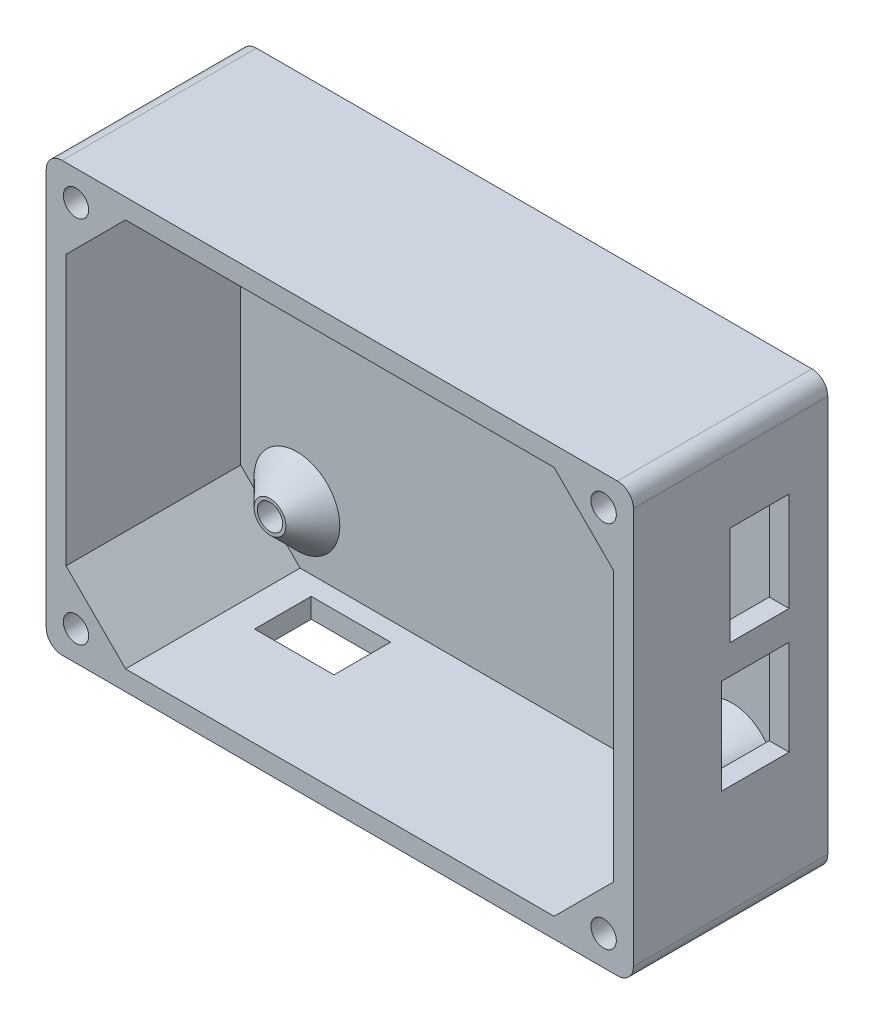
from build123d import *

# Parameters (mm, degrees)
SKETCH5_W           = 74
SKETCH5_H           = 54
BOSS_EXTRUDE4_DEPTH = 24.5
SHELL1_T            = -2.5
SKETCH6_R           = 2
BOSS_EXTRUDE5_DEPTH = 3.4
SKETCH11_R          = 1.6
CUT_EXTRUDE2_DEPTH  = 4.5
CUT_EXTRUDE4_REACH  = 84.494
SKETCH12_W          = 7.45
SKETCH12_H          = 12.5
CUT_EXTRUDE5_REACH  = 84.494
SKETCH13_W          = 8.5
SKETCH13_H          = 12
CUT_EXTRUDE6_REACH  = 71.895
SKETCH14_W          = 10
SKETCH14_H          = 7.138154435
BOSS_EXTRUDE7_DEPTH = 22
SKETCH9_R           = 1.6
CUT_EXTRUDE1_DEPTH  = 6.1
CHAMFER10_SIZE      = 3.4
CHAMFER11_SIZE      = 3.4
FILLET1_R           = 2


with BuildPart() as part:
    # Sketch5 → Boss-Extrude4 (new body)
    with BuildSketch(Plane.XY):
        Rectangle(SKETCH5_W, SKETCH5_H)
    extrude(amount=BOSS_EXTRUDE4_DEPTH)

    # Shell1
    shell1_openings = [part.faces().sort_by_distance(p)[0] for p in [
        (0, 0, 24.5),
    ]]
    offset(amount=SHELL1_T, openings=shell1_openings, kind=Kind.INTERSECTION)

    # Sketch6 → Boss-Extrude5 (add)
    with BuildSketch(Plane.XY.offset(2.5)):
        with Locations((-27.4, 17.4)):
            Circle(SKETCH6_R)
        with Locations((27.4, 17.4)):
            Circle(SKETCH6_R)
        with Locations((27.4, -17.4)):
            Circle(SKETCH6_R)
        with Locations((-27.4, -17.4)):
            Circle(SKETCH6_R)
    extrude(amount=BOSS_EXTRUDE5_DEPTH)

    # Sketch11 → Cut-Extrude2 (cut)
    with BuildSketch(Plane.XY.offset(5.9)):
        with Locations((-27.4, 17.4)):
            Circle(SKETCH11_R)
        with Locations((27.4, 17.4)):
            Circle(SKETCH11_R)
        with Locations((-27.4, -17.4)):
            Circle(SKETCH11_R)
        with Locations((27.4, -17.4)):
            Circle(SKETCH11_R)
    extrude(amount=-CUT_EXTRUDE2_DEPTH, mode=Mode.SUBTRACT)

    # Sketch12 → Cut-Extrude4 (cut, up to next)
    with BuildSketch(Plane(origin=(37, 0, 0), x_dir=(0, 0, -1), z_dir=(1, 0, 0)), mode=Mode.PRIVATE) as cut_extrude4_sk1:
        with Locations((-8.6, 10.53)):
            Rectangle(SKETCH12_W, SKETCH12_H)
    cut_extrude4_tool1 = extrude(cut_extrude4_sk1.sketch, amount=-CUT_EXTRUDE4_REACH, mode=Mode.PRIVATE) & part.part
    add(cut_extrude4_tool1.solids().sort_by_distance((37, 10.53, 8.6))[0], mode=Mode.SUBTRACT)

    # Sketch13 → Cut-Extrude5 (cut, up to next)
    with BuildSketch(Plane(origin=(37, 0, 0), x_dir=(0, 0, -1), z_dir=(1, 0, 0)), mode=Mode.PRIVATE) as cut_extrude5_sk1:
        with Locations((-9.125, -5.4)):
            Rectangle(SKETCH13_W, SKETCH13_H)
    cut_extrude5_tool1 = extrude(cut_extrude5_sk1.sketch, amount=-CUT_EXTRUDE5_REACH, mode=Mode.PRIVATE) & part.part
    add(cut_extrude5_tool1.solids().sort_by_distance((37, -5.4, 9.125))[0], mode=Mode.SUBTRACT)

    # Sketch14 → Cut-Extrude6 (cut, up to next)
    with BuildSketch(Plane.XZ.offset(27), mode=Mode.PRIVATE) as cut_extrude6_sk1:
        with Locations((-18.22, 8.449077218)):
            Rectangle(SKETCH14_W, SKETCH14_H)
    cut_extrude6_tool1 = extrude(cut_extrude6_sk1.sketch, amount=-CUT_EXTRUDE6_REACH, mode=Mode.PRIVATE) & part.part
    add(cut_extrude6_tool1.solids().sort_by_distance((-18.22, -27, 8.449077))[0], mode=Mode.SUBTRACT)

    # Sketch7 → Boss-Extrude7 (add)
    with BuildSketch(Plane.XY.offset(2.5)):
        Polygon((-27, 24.5), (-34.5, 17), (-34.5, 24.5), align=None)
        Polygon((-34.5, -17), (-27, -24.5), (-34.5, -24.5), align=None)
        Polygon((27, -24.5), (34.5, -17), (34.5, -24.5), align=None)
        Polygon((34.5, 17), (27, 24.5), (34.5, 24.5), align=None)
    extrude(amount=BOSS_EXTRUDE7_DEPTH)

    # Sketch9 → Cut-Extrude1 (cut)
    with BuildSketch(Plane.XY.offset(24.5)):
        with Locations((-33.25, 23.25)):
            Circle(SKETCH9_R)
        with Locations((33.25, 23.25)):
            Circle(SKETCH9_R)
        with Locations((-33.25, -23.25)):
            Circle(SKETCH9_R)
        with Locations((33.25, -23.25)):
            Circle(SKETCH9_R)
    extrude(amount=-CUT_EXTRUDE1_DEPTH, mode=Mode.SUBTRACT)

    # Chamfer10
    # the kernel refuses this chamfer: 3.4 mm, written as the material it adds along each edge
    with BuildSketch(Plane(origin=(-27.4, 17.4, 2.5), x_dir=(1, 0, 0), z_dir=(0, -1, 0))) as chamfer10_piece_1_section:
        Polygon((2 + CHAMFER10_SIZE, 0), (2, CHAMFER10_SIZE), (2, 0), align=None)
    chamfer10_piece_1 = revolve(axis=Axis((-27.4, 17.4, 2.5), (0, 0, 1)), mode=Mode.PRIVATE)
    chamfer10_piece_1 = split(chamfer10_piece_1, bisect_by=Plane(origin=(-31.112764442, 17.4, 5.9), z_dir=(0, 0, -1)), keep=Keep.TOP, mode=Mode.PRIVATE)
    add(chamfer10_piece_1)

    # Chamfer11
    # the kernel refuses this chamfer: 3.4 mm, written as the material it adds along each edge
    with BuildSketch(Plane(origin=(27.4, 17.4, 2.5), x_dir=(1, 0, 0), z_dir=(0, -1, 0))) as chamfer11_piece_1_section:
        Polygon((2 + CHAMFER11_SIZE, 0), (2, CHAMFER11_SIZE), (2, 0), align=None)
    chamfer11_piece_1 = revolve(axis=Axis((27.4, 17.4, 2.5), (0, 0, 1)), mode=Mode.PRIVATE)
    chamfer11_piece_1 = split(chamfer11_piece_1, bisect_by=Plane(origin=(23.687235558, 17.4, 5.9), z_dir=(0, 0, -1)), keep=Keep.TOP, mode=Mode.PRIVATE)
    add(chamfer11_piece_1)
    with BuildSketch(Plane(origin=(27.4, -17.4, 2.5), x_dir=(1, 0, 0), z_dir=(0, -1, 0))) as chamfer11_piece_2_section:
        Polygon((2 + CHAMFER11_SIZE, 0), (2, CHAMFER11_SIZE), (2, 0), align=None)
    chamfer11_piece_2 = revolve(axis=Axis((27.4, -17.4, 2.5), (0, 0, 1)), mode=Mode.PRIVATE)
    chamfer11_piece_2 = split(chamfer11_piece_2, bisect_by=Plane(origin=(23.687235558, -17.4, 5.9), z_dir=(0, 0, -1)), keep=Keep.TOP, mode=Mode.PRIVATE)
    add(chamfer11_piece_2)
    with BuildSketch(Plane(origin=(-27.4, -17.4, 2.5), x_dir=(1, 0, 0), z_dir=(0, -1, 0))) as chamfer11_piece_3_section:
        Polygon((2 + CHAMFER11_SIZE, 0), (2, CHAMFER11_SIZE), (2, 0), align=None)
    chamfer11_piece_3 = revolve(axis=Axis((-27.4, -17.4, 2.5), (0, 0, 1)), mode=Mode.PRIVATE)
    chamfer11_piece_3 = split(chamfer11_piece_3, bisect_by=Plane(origin=(-31.112764442, -17.4, 5.9), z_dir=(0, 0, -1)), keep=Keep.TOP, mode=Mode.PRIVATE)
    add(chamfer11_piece_3)

    # Fillet1
    fillet1_edges = [part.edges().sort_by_distance(p)[0] for p in [
        (37, -27, 12.25),
        (-37, -27, 12.25),
        (-37, 27, 12.25),
        (37, 27, 12.25),
    ]]
    fillet(fillet1_edges, radius=FILLET1_R)


solid = part.part
